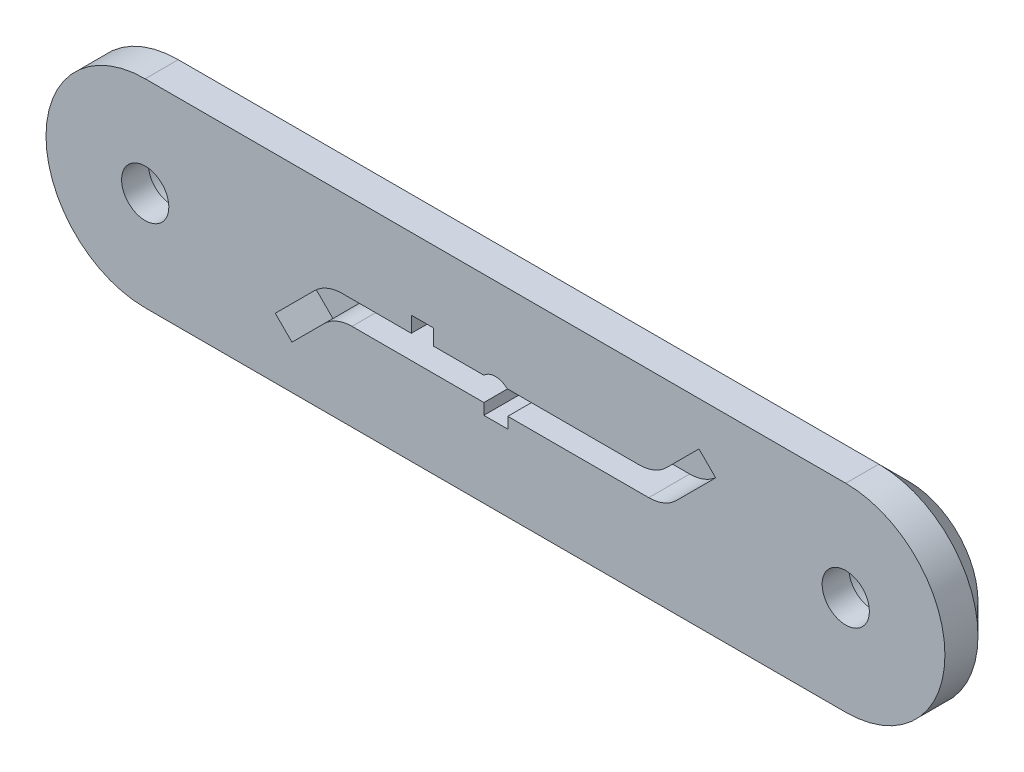
from build123d import *

# Parameters (mm, degrees)
BOSS_EXTRUDE1_DEPTH  = 4.5
BOSS_EXTRUDE2_DEPTH  = 4
CHAMFER2_START       = -4.2
CHAMFER2_2_DEPTH     = 4.2
CHAMFER2_START_2     = -8
CHAMFER2_3_OUTLINE_R = 8.8
CHAMFER2_3_DEPTH     = 3.8
SKETCH7_R            = 3
CUT_EXTRUDE3_DEPTH   = 103.673405561
SKETCH8_R            = 5.25
CUT_EXTRUDE4_DEPTH   = 4.6
CUT_EXTRUDE5_DEPTH   = 5.2


with BuildPart() as part:
    # Sketch1 → Boss-Extrude1 (new body)
    with BuildSketch(Plane.XY):
        with BuildLine():
            Line((0, 12.6), (88.982814426, 12.6))
            ThreePointArc((88.982814426, 12.6), (101.582814426, 0), (88.982814426, -12.6))
            Line((88.982814426, -12.6), (0, -12.6))
            ThreePointArc((0, -12.6), (-12.6, 0), (0, 12.6))
        make_face()
    extrude(amount=-BOSS_EXTRUDE1_DEPTH)

    # Sketch2 → Boss-Extrude2 (add)
    with BuildSketch(Plane.XY.offset(-8)):
        with BuildLine():
            Line((89.741407213, 8.85), (-0.758592787, 8.85))
            ThreePointArc((-0.758592787, 8.85), (-9.608592787, 0), (-0.758592787, -8.85))
            Line((-0.758592787, -8.85), (89.741407213, -8.85))
            ThreePointArc((89.741407213, -8.85), (98.591407213, 0), (89.741407213, 8.85))
        make_face()
    extrude(amount=BOSS_EXTRUDE2_DEPTH)

    # Chamfer2: read off the stored shape, not the designer's step
    # Chamfer2 outline → Chamfer2 (revolve)
    with BuildSketch(Plane.XZ):
        Polygon((8.8, -4.2), (8.8, -8), (12.6, -4.2), align=None)
    revolve(axis=Axis((0, 0, 0), (0, 0, 1)))

    # Chamfer2 2 outline → Chamfer2 2 (add)
    with BuildSketch(Plane.XY.offset(CHAMFER2_START)):
        with BuildLine():
            Line((88.982814426, 12.6), (0, 12.6))
            ThreePointArc((0, 12.6), (-12.6, 0), (0, -12.6))
            Line((0, -12.6), (88.982814426, -12.6))
            ThreePointArc((88.982814426, -12.6), (101.582814426, 0), (88.982814426, 12.6))
        make_face()
    extrude(amount=CHAMFER2_2_DEPTH)

    # Chamfer2 3 outline → Chamfer2 3 (add)
    with BuildSketch(Plane.XY.offset(CHAMFER2_START_2)):
        Circle(CHAMFER2_3_OUTLINE_R)
    extrude(amount=CHAMFER2_3_DEPTH)

    # Chamfer2 4: loft between two sections, ruled curve by curve
    chamfer2_4_from = [
        Edge.make_three_point_arc((88.982814426, -8.8, -8), (95.205354101, -6.222539674, -8), (97.782814426, 0, -8)),
        Edge.make_three_point_arc((97.782814426, 0, -8), (95.205354101, 6.222539674, -8), (88.982814426, 8.8, -8)),
        Edge.make_line((0, 8.8, -8), (88.982814426, 8.8, -8)),
        Edge.make_line((88.982814426, -8.8, -8), (0, -8.8, -8)),
        Edge.make_line((0, -8.8, -8), (0, 8.8, -8)),
    ]
    chamfer2_4_to = [
        Edge.make_three_point_arc((88.982814426, -12.6, -4.2), (97.892359869, -8.909545443, -4.2), (101.582814426, 0, -4.2)),
        Edge.make_three_point_arc((101.582814426, 0, -4.2), (97.892359869, 8.909545443, -4.2), (88.982814426, 12.6, -4.2)),
        Edge.make_line((0, 12.6, -4.2), (88.982814426, 12.6, -4.2)),
        Edge.make_line((88.982814426, -12.6, -4.2), (0, -12.6, -4.2)),
        Edge.make_line((0, -12.6, -4.2), (0, 12.6, -4.2)),
    ]
    chamfer2_4 = Solid(Shell([*[Face.make_surface_from_curves(chamfer2_4_from[k], chamfer2_4_to[k]) for k in range(5)], Face(Wire(chamfer2_4_from)), Face(Wire(chamfer2_4_to))]))
    add(chamfer2_4)

    # Sketch7 → Cut-Extrude3 (cut, through all)
    with BuildSketch(Plane.XY.offset(-8)):
        Circle(SKETCH7_R)
        with Locations((88.982814426, 0)):
            Circle(SKETCH7_R)
    extrude(amount=CUT_EXTRUDE3_DEPTH, mode=Mode.SUBTRACT)

    # Sketch8 → Cut-Extrude4 (cut)
    with BuildSketch(Plane.XY.offset(-8)):
        Circle(SKETCH8_R)
        with Locations((88.982814426, 0)):
            Circle(SKETCH8_R)
    extrude(amount=CUT_EXTRUDE4_DEPTH, mode=Mode.SUBTRACT)

    # Sketch9 → Cut-Extrude5 (cut)
    with BuildSketch(Plane.XY):
        with BuildLine():
            Line((22.732649866, -2.964466094), (18.644187371, -7.052928589))
            Line((18.644187371, -7.052928589), (16.522867028, -4.931608246))
            Line((16.522867028, -4.931608246), (21.490009179, 0.035533906))
            ThreePointArc((21.490009179, 0.035533906), (23.112125923, 1.119397663), (25.025543085, 1.5))
            Line((25.025543085, 1.5), (33.8, 1.5))
            Line((33.8, 1.5), (33.8, 3.5))
            Line((33.8, 3.5), (36.6, 3.5))
            Line((36.6, 3.5), (36.6, 1.5))
            Line((36.6, 1.5), (43.021713367, 1.5))
            ThreePointArc((43.021713367, 1.5), (44.491407213, 2.1), (45.961101059, 1.5))
            Line((45.961101059, 1.5), (62.714630654, 1.5))
            ThreePointArc((62.714630654, 1.5), (64.628047816, 1.880602337), (66.25016456, 2.964466094))
            Line((66.25016456, 2.964466094), (70.338627055, 7.052928589))
            Line((70.338627055, 7.052928589), (72.459947399, 4.931608246))
            Line((72.459947399, 4.931608246), (67.492805247, -0.035533906))
            ThreePointArc((67.492805247, -0.035533906), (65.870688503, -1.119397663), (63.957271341, -1.5))
            Line((63.957271341, -1.5), (46.05578497, -1.5))
            Line((46.05578497, -1.5), (46.05578497, -2.91))
            Line((46.05578497, -2.91), (43.021713367, -2.91))
            Line((43.021713367, -2.91), (43.021713367, -1.5))
            Line((43.021713367, -1.5), (26.268183772, -1.5))
            ThreePointArc((26.268183772, -1.5), (24.35476661, -1.880602337), (22.732649866, -2.964466094))
        make_face()
    extrude(amount=-CUT_EXTRUDE5_DEPTH, mode=Mode.SUBTRACT)


solid = part.part
